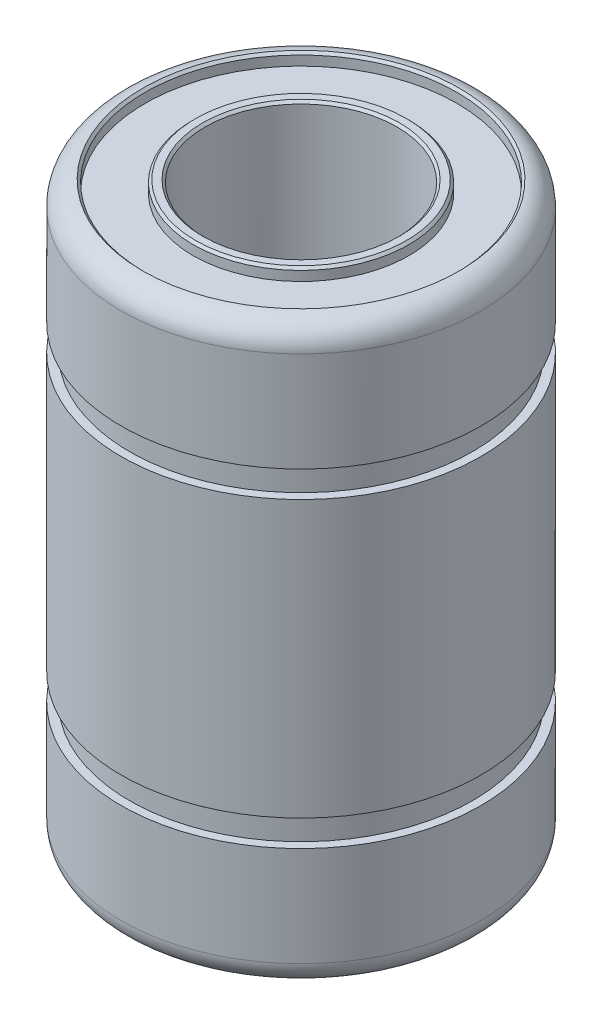
from build123d import *

# Parameters (mm, degrees)
CHAMFER1_SIZE = 0.1
FILLET1_R     = 1


with BuildPart() as part:
    # Sketch1 → Revolve1 (revolve)
    with BuildSketch(Plane.XY, mode=Mode.PRIVATE) as revolve1_sk:
        Polygon((4, 0), (4.5, 0), (4.5, 0.5), (6.5, 0.5), (6.5, 0), (7.5, 0), (7.5, 5.15), (7.15, 5.15), (7.15, 6.25), (7.5, 6.25), (7.5, 17.75), (7.15, 17.75), (7.15, 18.85), (7.5, 18.85), (7.5, 24), (6.5, 24), (6.5, 23.5), (4.5, 23.5), (4.5, 24), (4, 24), align=None)
    revolve(revolve1_sk.sketch.rotate(Axis((0, 0, 0), (0, 1, 0)), 90), axis=Axis((0, 0, 0), (0, 1, 0)))

    # Chamfer1
    chamfer1_edges = [part.edges().sort_by_distance(p)[0] for p in [
        (0, 0, 4),
        (0, 0, 4.5),
        (0, 0, 6.5),
        (0, 24, 6.5),
        (0, 24, 4.5),
        (0, 24, 4),
    ]]
    chamfer(chamfer1_edges, length=CHAMFER1_SIZE)

    # Fillet1
    # the kernel refuses this fillet: 1 mm, written as the material it takes off along each edge
    with BuildSketch(Plane(origin=(0, 0, 0), x_dir=(0, 0, -1), z_dir=(1, 0, 0))) as fillet1_piece_1:
        with BuildLine():
            CenterArc((6.5, 0.994987437), FILLET1_R, 275.739170477, 84.260829523)
            Line((7.5, 0.994987437), (7.52, 0.994987437))
            Line((7.52, 0.994987437), (7.52, 0))
            Line((7.52, 0), (7.5, -0.02))
            ThreePointArc((7.5, -0.02), (7.05, -0.02), (6.602, -0.019899749))
            Line((6.602, -0.019899749), (6.6, 0))
        make_face()
    revolve(axis=Axis((0, 0, 0), (0, 1, 0)), mode=Mode.SUBTRACT)
    with BuildSketch(Plane(origin=(0, 24, 0), x_dir=(0, 0, -1), z_dir=(1, 0, 0))) as fillet1_piece_2:
        with BuildLine():
            CenterArc((6.5, -0.994987437), FILLET1_R, 0, 84.260829523)
            Line((7.5, -0.994987437), (7.52, -0.994987437))
            Line((7.52, -0.994987437), (7.52, 0))
            Line((7.52, 0), (7.5, 0.02))
            ThreePointArc((7.5, 0.02), (7.05, 0.02), (6.602, 0.019899749))
            Line((6.602, 0.019899749), (6.6, 0))
        make_face()
    revolve(axis=Axis((0, 24, 0), (0, 1, 0)), mode=Mode.SUBTRACT)


solid = part.part
